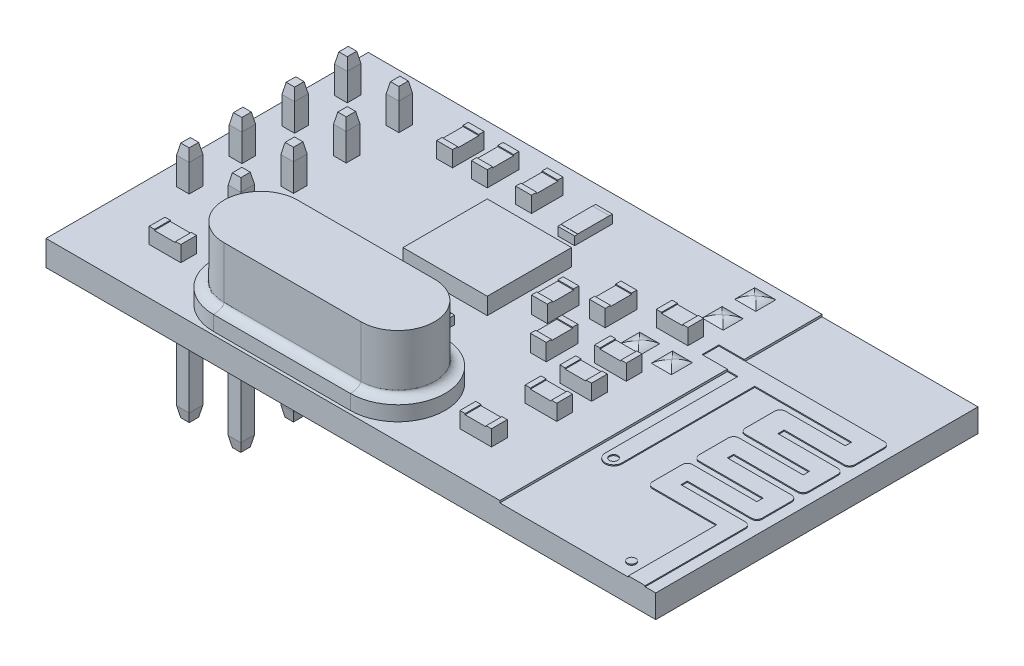
from build123d import *
from OCP.BRepFilletAPI import BRepFilletAPI_MakeChamfer

# Parameters (mm, degrees)
ESBO_O1_W                      = 28.95
ESBO_O1_H                      = 15.3
RESSALTO_EXTRUS_O1_DEPTH       = 1.2
CORTE_EXTRUS_O1_DEPTH          = 0.1
RESSALTO_EXTRUS_O2_DEPTH       = 0.05
ESBO_O4_R                      = 0.2
RESSALTO_EXTRUS_O3_DEPTH       = 0.05
RESSALTO_EXTRUS_O4_DEPTH       = 0.7
RESSALTO_EXTRUS_O5_DEPTH       = 2.7
CORTE_EXTRUS_O2_DEPTH          = 0.05
ESBO_O8_R                      = 0.2
CORTE_EXTRUS_O3_DEPTH          = 0.05
ESBO_O9_W                      = 1.5
ESBO_O9_H                      = 0.75
ESBO_O9_W_2                    = 0.75
ESBO_O9_H_2                    = 1.5
RESSALTO_EXTRUS_O6_DEPTH       = 0.75
FILETE1_SIZE                   = 0.5
FILETE1_SIZE_2                 = 0.25
ESBO_O10_W                     = 5
ESBO_O10_H                     = 2.5
RESSALTO_EXTRUS_O7_DEPTH       = 2.6
CHANFRO2_SIZE                  = 0.709219858
ESBO_O11_W                     = 5
ESBO_O11_H                     = 2.5
RESSALTO_EXTRUS_O8_DEPTH       = 2.6
CHANFRO3_SIZE                  = 0.709219858
ESBO_O12_W                     = 5
ESBO_O12_H                     = 2.5
RESSALTO_EXTRUS_O9_DEPTH       = 2.6
CHANFRO4_SIZE                  = 0.709219858
ESBO_O13_W                     = 5
ESBO_O13_H                     = 2.5
RESSALTO_EXTRUS_O10_DEPTH      = 2.6
CHANFRO5_SIZE                  = 0.709219858
ESBO_O15_W                     = 4
ESBO_O15_H                     = 4
RESSALTO_EXTRUS_O12_DEPTH      = 0.8
ESBO_O16_W                     = 1.8
ESBO_O16_H                     = 0.8
ESBO_O16_W_2                   = 0.8
ESBO_O16_H_2                   = 1.8
RESSALTO_EXTRUS_O13_DEPTH      = 0.4
ESBO_O17_W                     = 0.75
ESBO_O17_H                     = 1.5
RESSALTO_EXTRUS_O14_DEPTH      = 0.8
ESBO_O18_W                     = 0.75
ESBO_O18_H                     = 1
CORTE_EXTRUS_O4_DEPTH          = 0.05
ESBO_O19_W                     = 0.75
ESBO_O19_H                     = 1
ESBO_O19_W_2                   = 1
ESBO_O19_H_2                   = 0.75
CORTE_EXTRUS_O5_DEPTH          = 0.05
ESBO_O20_W                     = 1.5
ESBO_O20_H                     = 0.8
ESBO_O20_W_2                   = 0.8
ESBO_O20_H_2                   = 1.5
RESSALTO_EXTRUS_O15_DEPTH      = 0.01
ESBO_O21_W                     = 1.081560284
ESBO_O21_H                     = 2.6
CORTE_EXTRUS_O6_DEPTH          = 0.001
ESBO_O22_W                     = 3
ESBO_O22_H                     = 1
CORTE_EXTRUS_O7_DEPTH          = 21.860863477
RESSALTO_EXTRUS_O16_DEPTH      = 5.7
RESSALTO_EXTRUS_O16_DEPTH_BACK = 5.6
ESBO_O14_W                     = 0.6
ESBO_O14_H                     = 0.65
CHANFRO8_SIZE                  = 0.5
CHANFRO8_SIZE2                 = 0.1
CHANFRO9_SIZE                  = 0.1
CHANFRO9_SIZE2                 = 0.5
ESBO_O23_W                     = 1
ESBO_O23_H                     = 0.95
ESBO_O23_W_2                   = 0.95
ESBO_O23_H_2                   = 1
RESSALTO_EXTRUS_O17_DEPTH      = 0.15
FILETE2_R                      = 0.75
FILETE3_R                      = 0.25


# Some blends are built 0.0001 mm under size
with BuildPart() as part:
    # Esboço1 → Ressalto-extrusão1 (new body)
    with BuildSketch(Plane(origin=(0, 0, 0), x_dir=(1, 0, 0), z_dir=(0, 1, 0))):
        Rectangle(ESBO_O1_W, ESBO_O1_H)
    extrude(amount=RESSALTO_EXTRUS_O1_DEPTH)

    # Esboço2 → Corte-extrusão1 (cut)
    with BuildSketch(Plane(origin=(0, 1.2, 0), x_dir=(1, 0, 0), z_dir=(0, 1, 0))):
        Polygon((14.475, 7.65), (7.075, 7.65), (7.075, 3.95), (5.875, 3.95), (5.875, 3.15), (7.075, 3.15), (7.075, -7.65), (14.475, -7.65), align=None)
    extrude(amount=-CORTE_EXTRUS_O1_DEPTH, mode=Mode.SUBTRACT)

    # Esboço3 → Ressalto-extrusão2 (add)
    with BuildSketch(Plane(origin=(0, 1.1, 0), x_dir=(1, 0, 0), z_dir=(0, 1, 0))):
        Polygon((7.075, 3.95), (13.975, 3.95), (13.975, 2.05), (10.875, 2.05), (10.875, 1.75), (13.975, 1.75), (13.975, -0.15), (10.675, -0.15), (10.675, -0.45), (13.975, -0.45), (13.975, -2.35), (10.675, -2.35), (10.675, -2.65), (13.975, -2.65), (13.975, -7.65), (13.175, -7.65), (13.175, -3.45), (9.875, -3.45), (9.875, -1.55), (13.175, -1.55), (13.175, -1.25), (9.875, -1.25), (9.875, 0.65), (13.175, 0.65), (13.175, 0.95), (9.875, 0.95), (9.875, 2.85), (12.975, 2.85), (12.975, 3.15), (8.375, 3.15), (8.375, -3.55), (7.575, -3.55), (7.575, 3.15), (7.075, 3.15), (5.875, 3.15), (5.875, 3.95), align=None)
    extrude(amount=RESSALTO_EXTRUS_O2_DEPTH)

    # Esboço4 → Ressalto-extrusão3 (add)
    with BuildSketch(Plane(origin=(0, 1.1, 0), x_dir=(1, 0, 0), z_dir=(0, 1, 0))):
        with Locations(Location((12.625, -6.95, 0), (0, 0, 90))):
            Circle(ESBO_O4_R)
    extrude(amount=RESSALTO_EXTRUS_O3_DEPTH)

    # Esboço5 → Ressalto-extrusão4 (add)
    with BuildSketch(Plane(origin=(0, 1.2, 0), x_dir=(1, 0, 0), z_dir=(0, 1, 0))):
        with BuildLine():
            Line((-6.675, -3), (-0.175, -3))
            ThreePointArc((-0.175, -3), (2.075, -5.25), (-0.175, -7.5))
            Line((-0.175, -7.5), (-6.675, -7.5))
            ThreePointArc((-6.675, -7.5), (-8.925, -5.25), (-6.675, -3))
        make_face()
    extrude(amount=RESSALTO_EXTRUS_O4_DEPTH)

    # Esboço6 → Ressalto-extrusão5 (add)
    with BuildSketch(Plane(origin=(0, 1.9, 0), x_dir=(1, 0, 0), z_dir=(0, 1, 0))):
        with BuildLine():
            Line((-6.675, -3.5), (-0.175, -3.5))
            ThreePointArc((-0.175, -3.5), (1.575, -5.25), (-0.175, -7))
            Line((-0.175, -7), (-6.675, -7))
            ThreePointArc((-6.675, -7), (-8.425, -5.25), (-6.675, -3.5))
        make_face()
    extrude(amount=RESSALTO_EXTRUS_O5_DEPTH)

    # Esboço7 → Corte-extrusão2 (cut)
    with BuildSketch(Plane(origin=(0, 1.15, 0), x_dir=(1, 0, 0), z_dir=(0, 1, 0))):
        with BuildLine():
            ThreePointArc((8.375, -3.15), (8.257842712, -3.432842712), (7.975, -3.55))
            Line((7.975, -3.55), (8.375, -3.55))
            Line((8.375, -3.55), (8.375, -3.15))
        make_face()
        with BuildLine():
            ThreePointArc((7.975, -3.55), (7.692157288, -3.432842712), (7.575, -3.15))
            Line((7.575, -3.15), (7.575, -3.55))
            Line((7.575, -3.55), (7.975, -3.55))
        make_face()
    extrude(amount=-CORTE_EXTRUS_O2_DEPTH, mode=Mode.SUBTRACT)

    # Esboço8 → Corte-extrusão3 (cut)
    with BuildSketch(Plane(origin=(0, 1.15, 0), x_dir=(1, 0, 0), z_dir=(0, 1, 0))):
        with Locations(Location((7.975, -3.15, 0), (0, 0, 270))):
            Circle(ESBO_O8_R)
    extrude(amount=-CORTE_EXTRUS_O3_DEPTH, mode=Mode.SUBTRACT)

    # Esboço9 → Ressalto-extrusão6 (add)
    with BuildSketch(Plane(origin=(0, 1.2, 0), x_dir=(1, 0, 0), z_dir=(0, 1, 0))):
        with Locations((-11.025, -5.075)):
            Rectangle(ESBO_O9_W, ESBO_O9_H)
        with Locations((3.925, -5.275)):
            Rectangle(ESBO_O9_W, ESBO_O9_H)
        with Locations((4.425, -2.675)):
            Rectangle(ESBO_O9_W, ESBO_O9_H)
        with Locations((4.425, -1.025)):
            Rectangle(ESBO_O9_W, ESBO_O9_H)
        with Locations((4.425, 0.625)):
            Rectangle(ESBO_O9_W, ESBO_O9_H)
        with Locations((4.425, 3.55)):
            Rectangle(ESBO_O9_W, ESBO_O9_H)
        with Locations((-8.1, 5.65)):
            Rectangle(ESBO_O9_W_2, ESBO_O9_H_2)
        with Locations((-6.45, 5.65)):
            Rectangle(ESBO_O9_W_2, ESBO_O9_H_2)
        with Locations((-4.35, 5.65)):
            Rectangle(ESBO_O9_W_2, ESBO_O9_H_2)
    extrude(amount=RESSALTO_EXTRUS_O6_DEPTH)

    # Filete1
    # a fillet whose section is not a circle: 0.5, 0.25 mm, written as the material it adds along each edge
    with BuildSketch(Plane(origin=(-6.675, 1.9, 5.25), x_dir=(0, 0, 1), z_dir=(1, 0, 0))) as filete1_piece_1:
        with BuildLine():
            Bezier((1.75 + FILETE1_SIZE, 0), (1.75, 0), (1.75, -FILETE1_SIZE_2), weights=[1, 0.707106781, 1])
            Line((1.75, -FILETE1_SIZE_2), (1.75, 0))
            Line((1.75, 0), (1.75 + FILETE1_SIZE, 0))
        make_face()
    revolve(axis=Axis((-6.675, 1.9, 5.25), (0, -1, 0)), revolution_arc=180)
    with BuildSketch(Plane(origin=(-0.175, 1.9, 7), x_dir=(0, 0, 1), z_dir=(-1, 0, 0)), Plane(origin=(-6.675, 1.9, 3.5), x_dir=(0, 0, -1), z_dir=(1, 0, 0))) as filete1_piece_2:
        with BuildLine():
            Bezier((FILETE1_SIZE, 0), (0, 0), (0, FILETE1_SIZE_2), weights=[1, 0.707106781, 1])
            Line((0, FILETE1_SIZE_2), (0, 0))
            Line((0, 0), (FILETE1_SIZE, 0))
        make_face()
    extrude(amount=6.5)
    with BuildSketch(Plane(origin=(-0.175, 1.9, 5.25), x_dir=(0, 0, -1), z_dir=(-1, 0, 0))) as filete1_piece_3:
        with BuildLine():
            Bezier((1.75 + FILETE1_SIZE, 0), (1.75, 0), (1.75, -FILETE1_SIZE_2), weights=[1, 0.707106781, 1])
            Line((1.75, -FILETE1_SIZE_2), (1.75, 0))
            Line((1.75, 0), (1.75 + FILETE1_SIZE, 0))
        make_face()
    revolve(axis=Axis((-0.175, 1.9, 5.25), (0, -1, 0)), revolution_arc=180)

    # Esboço10 → Ressalto-extrusão7 (add)
    with BuildSketch(Plane.XZ):
        with Locations((-11.975, -5.4)):
            Rectangle(ESBO_O10_W, ESBO_O10_H)
    extrude(amount=RESSALTO_EXTRUS_O7_DEPTH)

    # Chanfro2
    chanfro2_edges = [part.edges().sort_by_distance(p)[0] for p in [
        (-14.475, -1.3, -4.15),
        (-9.475, -1.3, -4.15),
    ]]
    chamfer(chanfro2_edges, length=CHANFRO2_SIZE)

    # Esboço11 → Ressalto-extrusão8 (add)
    with BuildSketch(Plane.XZ):
        with Locations((-11.975, -2.9)):
            Rectangle(ESBO_O11_W, ESBO_O11_H)
    extrude(amount=RESSALTO_EXTRUS_O8_DEPTH)

    # Chanfro3
    chanfro3_edges = [part.edges().sort_by_distance(p)[0] for p in [
        (-14.475, -1.3, -1.65),
        (-9.475, -1.3, -1.65),
    ]]
    chamfer(chanfro3_edges, length=CHANFRO3_SIZE)

    # Esboço12 → Ressalto-extrusão9 (add)
    with BuildSketch(Plane.XZ):
        with Locations((-11.975, -0.4)):
            Rectangle(ESBO_O12_W, ESBO_O12_H)
    extrude(amount=RESSALTO_EXTRUS_O9_DEPTH)

    # Chanfro4
    chanfro4_edges = [part.edges().sort_by_distance(p)[0] for p in [
        (-14.475, -1.3, 0.85),
        (-9.475, -1.3, 0.85),
    ]]
    chamfer(chanfro4_edges, length=CHANFRO4_SIZE)

    # Esboço13 → Ressalto-extrusão10 (add)
    with BuildSketch(Plane.XZ):
        with Locations((-11.975, 2.1)):
            Rectangle(ESBO_O13_W, ESBO_O13_H)
    extrude(amount=RESSALTO_EXTRUS_O10_DEPTH)

    # Chanfro5
    chanfro5_edges = [part.edges().sort_by_distance(p)[0] for p in [
        (-9.475, -1.3, -6.65),
        (-14.475, -1.3, -6.65),
        (-9.475, -1.3, -4.15),
        (-14.475, -1.3, -4.15),
        (-9.475, -1.3, -1.65),
        (-14.475, -1.3, -1.65),
        (-14.475, -1.3, 0.85),
        (-9.475, -1.3, 0.85),
        (-9.475, -1.3, 3.35),
        (-14.475, -1.3, 3.35),
    ]]
    chamfer(chanfro5_edges, length=CHANFRO5_SIZE - 0.0001)  # a hair under: the kernel refuses the full size

    # Esboço15 → Ressalto-extrusão12 (add)
    with BuildSketch(Plane(origin=(0, 1.2, 0), x_dir=(1, 0, 0), z_dir=(0, 1, 0))):
        with Locations((-2.825, 1.65)):
            Rectangle(ESBO_O15_W, ESBO_O15_H)
    extrude(amount=RESSALTO_EXTRUS_O12_DEPTH)

    # Esboço16 → Ressalto-extrusão13 (add)
    with BuildSketch(Plane(origin=(0, 1.2, 0), x_dir=(1, 0, 0), z_dir=(0, 1, 0))):
        with Locations((-2.125, -1.9)):
            Rectangle(ESBO_O16_W, ESBO_O16_H)
        with Locations((-2.025, 5.5)):
            Rectangle(ESBO_O16_W_2, ESBO_O16_H_2)
    extrude(amount=RESSALTO_EXTRUS_O13_DEPTH)

    # Esboço17 → Ressalto-extrusão14 (add)
    with BuildSketch(Plane(origin=(0, 1.2, 0), x_dir=(1, 0, 0), z_dir=(0, 1, 0))):
        with Locations((0.55, 1.5)):
            Rectangle(ESBO_O17_W, ESBO_O17_H)
        with Locations((2.1, -0.1)):
            Rectangle(ESBO_O17_W, ESBO_O17_H)
        with Locations((2.1, 2.7)):
            Rectangle(ESBO_O17_W, ESBO_O17_H)
    extrude(amount=RESSALTO_EXTRUS_O14_DEPTH)

    # Esboço18 → Corte-extrusão4 (cut)
    with BuildSketch(Plane(origin=(0, 2, 0), x_dir=(1, 0, 0), z_dir=(0, 1, 0))):
        with Locations((2.1, -0.1)):
            Rectangle(ESBO_O18_W, ESBO_O18_H)
        with Locations((0.55, 1.5)):
            Rectangle(ESBO_O18_W, ESBO_O18_H)
        with Locations((2.1, 2.7)):
            Rectangle(ESBO_O18_W, ESBO_O18_H)
    extrude(amount=-CORTE_EXTRUS_O4_DEPTH, mode=Mode.SUBTRACT)

    # Esboço19 → Corte-extrusão5 (cut)
    with BuildSketch(Plane(origin=(0, 1.95, 0), x_dir=(1, 0, 0), z_dir=(0, 1, 0))):
        with Locations((-4.35, 5.65)):
            Rectangle(ESBO_O19_W, ESBO_O19_H)
        with Locations((-6.45, 5.65)):
            Rectangle(ESBO_O19_W, ESBO_O19_H)
        with Locations((-8.1, 5.65)):
            Rectangle(ESBO_O19_W, ESBO_O19_H)
        with Locations((4.425, 3.55)):
            Rectangle(ESBO_O19_W_2, ESBO_O19_H_2)
        with Locations((4.425, 0.625)):
            Rectangle(ESBO_O19_W_2, ESBO_O19_H_2)
        with Locations((4.425, -1.025)):
            Rectangle(ESBO_O19_W_2, ESBO_O19_H_2)
        with Locations((4.425, -2.675)):
            Rectangle(ESBO_O19_W_2, ESBO_O19_H_2)
        with Locations((3.925, -5.275)):
            Rectangle(ESBO_O19_W_2, ESBO_O19_H_2)
        with Locations((-11.025, -5.075)):
            Rectangle(ESBO_O19_W_2, ESBO_O19_H_2)
    extrude(amount=-CORTE_EXTRUS_O5_DEPTH, mode=Mode.SUBTRACT)

    # Esboço20 → Ressalto-extrusão15 (add)
    with BuildSketch(Plane(origin=(0, 1.6, 0), x_dir=(1, 0, 0), z_dir=(0, 1, 0))):
        with Locations((-2.125, -1.9)):
            Rectangle(ESBO_O20_W, ESBO_O20_H)
        with Locations((-2.025, 5.5)):
            Rectangle(ESBO_O20_W_2, ESBO_O20_H_2)
    extrude(amount=RESSALTO_EXTRUS_O15_DEPTH)

    # Esboço21 → Corte-extrusão6 (cut)
    with BuildSketch(Plane.ZY.offset(14.475)):
        with Locations((2.1, -1.3)):
            Rectangle(ESBO_O21_W, ESBO_O21_H)
        with Locations((-0.4, -1.3)):
            Rectangle(ESBO_O21_W, ESBO_O21_H)
        with Locations((-2.9, -1.3)):
            Rectangle(ESBO_O21_W, ESBO_O21_H)
        with Locations((-5.4, -1.3)):
            Rectangle(ESBO_O21_W, ESBO_O21_H)
    extrude(amount=-CORTE_EXTRUS_O6_DEPTH, mode=Mode.SUBTRACT)

    # Esboço22 → Corte-extrusão7 (cut, through all)
    with BuildSketch(Plane(origin=(0, 0, -6.65), x_dir=(-1, 0, 0), z_dir=(0, 0, -1))):
        with Locations((11.974219858, -0.5)):
            Rectangle(ESBO_O22_W, ESBO_O22_H)
    extrude(amount=-CORTE_EXTRUS_O7_DEPTH, mode=Mode.SUBTRACT)

    # Esboço14 → Ressalto-extrusão16 (add, two sides: drawn at the far end of the back side and taken through both)
    with BuildSketch(Plane.XZ.offset(2.6).offset(-RESSALTO_EXTRUS_O16_DEPTH_BACK)):
        with Locations((-13.2, 2.1)):
            Rectangle(ESBO_O14_W, ESBO_O14_H)
        with Locations((-10.75, 2.1)):
            Rectangle(ESBO_O14_W, ESBO_O14_H)
        with Locations((-13.2, -0.4)):
            Rectangle(ESBO_O14_W, ESBO_O14_H)
        with Locations((-10.75, -0.4)):
            Rectangle(ESBO_O14_W, ESBO_O14_H)
        with Locations((-13.196951429, -2.9)):
            Rectangle(ESBO_O14_W, ESBO_O14_H)
        with Locations((-10.746951429, -2.9)):
            Rectangle(ESBO_O14_W, ESBO_O14_H)
        with Locations((-13.196951429, -5.4)):
            Rectangle(ESBO_O14_W, ESBO_O14_H)
        with Locations((-10.746951429, -5.4)):
            Rectangle(ESBO_O14_W, ESBO_O14_H)
    extrude(amount=RESSALTO_EXTRUS_O16_DEPTH + RESSALTO_EXTRUS_O16_DEPTH_BACK)

    # Chanfro8: one chamfer whose edges measure the first distance from different faces: ONE call of the kernel's chamfer builder (chamfer() names one face for all edges)
    chanfro8_edges_1 = [part.edges().sort_by_distance(p)[0] for p in [
        (-11.05, -8.3, -0.4),
    ]]
    chanfro8_side_1 = [part.faces().sort_by_distance(p)[0] for p in [
        (-11.05, -5.45, -0.4),
    ]]
    chanfro8_edges_2 = [part.edges().sort_by_distance(p)[0] for p in [
        (-10.75, -8.3, -0.725),
    ]]
    chanfro8_side_2 = [part.faces().sort_by_distance(p)[0] for p in [
        (-10.75, -5.45, -0.725),
    ]]
    chanfro8_edges_3 = [part.edges().sort_by_distance(p)[0] for p in [
        (-10.45, -8.3, -0.4),
    ]]
    chanfro8_side_3 = [part.faces().sort_by_distance(p)[0] for p in [
        (-10.45, -5.45, -0.4),
    ]]
    chanfro8_edges_4 = [part.edges().sort_by_distance(p)[0] for p in [
        (-10.75, -8.3, -0.075),
    ]]
    chanfro8_side_4 = [part.faces().sort_by_distance(p)[0] for p in [
        (-10.75, -5.45, -0.075),
    ]]
    chanfro8_edges_5 = [part.edges().sort_by_distance(p)[0] for p in [
        (-13.496951429, -8.3, -2.9),
    ]]
    chanfro8_side_5 = [part.faces().sort_by_distance(p)[0] for p in [
        (-13.496951429, -5.45, -2.9),
    ]]
    chanfro8_edges_6 = [part.edges().sort_by_distance(p)[0] for p in [
        (-13.196951429, -8.3, -3.225),
    ]]
    chanfro8_side_6 = [part.faces().sort_by_distance(p)[0] for p in [
        (-13.196951429, -5.45, -3.225),
    ]]
    chanfro8_edges_7 = [part.edges().sort_by_distance(p)[0] for p in [
        (-12.896951429, -8.3, -2.9),
    ]]
    chanfro8_side_7 = [part.faces().sort_by_distance(p)[0] for p in [
        (-12.896951429, -5.45, -2.9),
    ]]
    chanfro8_edges_8 = [part.edges().sort_by_distance(p)[0] for p in [
        (-13.196951429, -8.3, -2.575),
    ]]
    chanfro8_side_8 = [part.faces().sort_by_distance(p)[0] for p in [
        (-13.196951429, -5.45, -2.575),
    ]]
    chanfro8_edges_9 = [part.edges().sort_by_distance(p)[0] for p in [
        (-11.046951429, -8.3, -2.9),
    ]]
    chanfro8_side_9 = [part.faces().sort_by_distance(p)[0] for p in [
        (-11.046951429, -5.45, -2.9),
    ]]
    chanfro8_edges_10 = [part.edges().sort_by_distance(p)[0] for p in [
        (-10.746951429, -8.3, -3.225),
    ]]
    chanfro8_side_10 = [part.faces().sort_by_distance(p)[0] for p in [
        (-10.746951429, -5.45, -3.225),
    ]]
    chanfro8_edges_11 = [part.edges().sort_by_distance(p)[0] for p in [
        (-10.446951429, -8.3, -2.9),
    ]]
    chanfro8_side_11 = [part.faces().sort_by_distance(p)[0] for p in [
        (-10.446951429, -5.45, -2.9),
    ]]
    chanfro8_edges_12 = [part.edges().sort_by_distance(p)[0] for p in [
        (-10.746951429, -8.3, -2.575),
    ]]
    chanfro8_side_12 = [part.faces().sort_by_distance(p)[0] for p in [
        (-10.746951429, -5.45, -2.575),
    ]]
    chanfro8_edges_13 = [part.edges().sort_by_distance(p)[0] for p in [
        (-13.496951429, -8.3, -5.4),
    ]]
    chanfro8_side_13 = [part.faces().sort_by_distance(p)[0] for p in [
        (-13.496951429, -5.45, -5.4),
    ]]
    chanfro8_edges_14 = [part.edges().sort_by_distance(p)[0] for p in [
        (-13.196951429, -8.3, -5.725),
    ]]
    chanfro8_side_14 = [part.faces().sort_by_distance(p)[0] for p in [
        (-13.196951429, -5.45, -5.725),
    ]]
    chanfro8_edges_15 = [part.edges().sort_by_distance(p)[0] for p in [
        (-12.896951429, -8.3, -5.4),
    ]]
    chanfro8_side_15 = [part.faces().sort_by_distance(p)[0] for p in [
        (-12.896951429, -5.45, -5.4),
    ]]
    chanfro8_edges_16 = [part.edges().sort_by_distance(p)[0] for p in [
        (-13.196951429, -8.3, -5.075),
    ]]
    chanfro8_side_16 = [part.faces().sort_by_distance(p)[0] for p in [
        (-13.196951429, -5.45, -5.075),
    ]]
    chanfro8_edges_17 = [part.edges().sort_by_distance(p)[0] for p in [
        (-11.046951429, -8.3, -5.4),
    ]]
    chanfro8_side_17 = [part.faces().sort_by_distance(p)[0] for p in [
        (-11.046951429, -5.45, -5.4),
    ]]
    chanfro8_edges_18 = [part.edges().sort_by_distance(p)[0] for p in [
        (-10.746951429, -8.3, -5.725),
    ]]
    chanfro8_side_18 = [part.faces().sort_by_distance(p)[0] for p in [
        (-10.746951429, -5.45, -5.725),
    ]]
    chanfro8_edges_19 = [part.edges().sort_by_distance(p)[0] for p in [
        (-10.446951429, -8.3, -5.4),
    ]]
    chanfro8_side_19 = [part.faces().sort_by_distance(p)[0] for p in [
        (-10.446951429, -5.45, -5.4),
    ]]
    chanfro8_edges_20 = [part.edges().sort_by_distance(p)[0] for p in [
        (-10.746951429, -8.3, -5.075),
    ]]
    chanfro8_side_20 = [part.faces().sort_by_distance(p)[0] for p in [
        (-10.746951429, -5.45, -5.075),
    ]]
    chanfro8_edges_21 = [part.edges().sort_by_distance(p)[0] for p in [
        (-13.5, -8.3, 2.1),
    ]]
    chanfro8_side_21 = [part.faces().sort_by_distance(p)[0] for p in [
        (-13.5, -5.45, 2.1),
    ]]
    chanfro8_edges_22 = [part.edges().sort_by_distance(p)[0] for p in [
        (-13.2, -8.3, 1.775),
    ]]
    chanfro8_side_22 = [part.faces().sort_by_distance(p)[0] for p in [
        (-13.2, -5.45, 1.775),
    ]]
    chanfro8_edges_23 = [part.edges().sort_by_distance(p)[0] for p in [
        (-12.9, -8.3, 2.1),
    ]]
    chanfro8_side_23 = [part.faces().sort_by_distance(p)[0] for p in [
        (-12.9, -5.45, 2.1),
    ]]
    chanfro8_edges_24 = [part.edges().sort_by_distance(p)[0] for p in [
        (-13.2, -8.3, 2.425),
    ]]
    chanfro8_side_24 = [part.faces().sort_by_distance(p)[0] for p in [
        (-13.2, -5.45, 2.425),
    ]]
    chanfro8_edges_25 = [part.edges().sort_by_distance(p)[0] for p in [
        (-11.05, -8.3, 2.1),
    ]]
    chanfro8_side_25 = [part.faces().sort_by_distance(p)[0] for p in [
        (-11.05, -5.45, 2.1),
    ]]
    chanfro8_edges_26 = [part.edges().sort_by_distance(p)[0] for p in [
        (-10.75, -8.3, 1.775),
    ]]
    chanfro8_side_26 = [part.faces().sort_by_distance(p)[0] for p in [
        (-10.75, -5.45, 1.775),
    ]]
    chanfro8_edges_27 = [part.edges().sort_by_distance(p)[0] for p in [
        (-10.45, -8.3, 2.1),
    ]]
    chanfro8_side_27 = [part.faces().sort_by_distance(p)[0] for p in [
        (-10.45, -5.45, 2.1),
    ]]
    chanfro8_edges_28 = [part.edges().sort_by_distance(p)[0] for p in [
        (-10.75, -8.3, 2.425),
    ]]
    chanfro8_side_28 = [part.faces().sort_by_distance(p)[0] for p in [
        (-10.75, -5.45, 2.425),
    ]]
    chanfro8_edges_29 = [part.edges().sort_by_distance(p)[0] for p in [
        (-13.5, -8.3, -0.4),
    ]]
    chanfro8_side_29 = [part.faces().sort_by_distance(p)[0] for p in [
        (-13.5, -5.45, -0.4),
    ]]
    chanfro8_edges_30 = [part.edges().sort_by_distance(p)[0] for p in [
        (-13.2, -8.3, -0.725),
    ]]
    chanfro8_side_30 = [part.faces().sort_by_distance(p)[0] for p in [
        (-13.2, -5.45, -0.725),
    ]]
    chanfro8_edges_31 = [part.edges().sort_by_distance(p)[0] for p in [
        (-12.9, -8.3, -0.4),
    ]]
    chanfro8_side_31 = [part.faces().sort_by_distance(p)[0] for p in [
        (-12.9, -5.45, -0.4),
    ]]
    chanfro8_edges_32 = [part.edges().sort_by_distance(p)[0] for p in [
        (-13.2, -8.3, -0.075),
    ]]
    chanfro8_side_32 = [part.faces().sort_by_distance(p)[0] for p in [
        (-13.2, -5.45, -0.075),
    ]]
    chanfro8 = BRepFilletAPI_MakeChamfer(part.part.solid().wrapped)
    for e in chanfro8_edges_1:
        chanfro8.Add(CHANFRO8_SIZE, CHANFRO8_SIZE2, e.wrapped, chanfro8_side_1[0].wrapped)  # the first distance lies on this face
    for e in chanfro8_edges_2:
        chanfro8.Add(CHANFRO8_SIZE, CHANFRO8_SIZE2, e.wrapped, chanfro8_side_2[0].wrapped)  # the first distance lies on this face
    for e in chanfro8_edges_3:
        chanfro8.Add(CHANFRO8_SIZE, CHANFRO8_SIZE2, e.wrapped, chanfro8_side_3[0].wrapped)  # the first distance lies on this face
    for e in chanfro8_edges_4:
        chanfro8.Add(CHANFRO8_SIZE, CHANFRO8_SIZE2, e.wrapped, chanfro8_side_4[0].wrapped)  # the first distance lies on this face
    for e in chanfro8_edges_5:
        chanfro8.Add(CHANFRO8_SIZE, CHANFRO8_SIZE2, e.wrapped, chanfro8_side_5[0].wrapped)  # the first distance lies on this face
    for e in chanfro8_edges_6:
        chanfro8.Add(CHANFRO8_SIZE, CHANFRO8_SIZE2, e.wrapped, chanfro8_side_6[0].wrapped)  # the first distance lies on this face
    for e in chanfro8_edges_7:
        chanfro8.Add(CHANFRO8_SIZE, CHANFRO8_SIZE2, e.wrapped, chanfro8_side_7[0].wrapped)  # the first distance lies on this face
    for e in chanfro8_edges_8:
        chanfro8.Add(CHANFRO8_SIZE, CHANFRO8_SIZE2, e.wrapped, chanfro8_side_8[0].wrapped)  # the first distance lies on this face
    for e in chanfro8_edges_9:
        chanfro8.Add(CHANFRO8_SIZE, CHANFRO8_SIZE2, e.wrapped, chanfro8_side_9[0].wrapped)  # the first distance lies on this face
    for e in chanfro8_edges_10:
        chanfro8.Add(CHANFRO8_SIZE, CHANFRO8_SIZE2, e.wrapped, chanfro8_side_10[0].wrapped)  # the first distance lies on this face
    for e in chanfro8_edges_11:
        chanfro8.Add(CHANFRO8_SIZE, CHANFRO8_SIZE2, e.wrapped, chanfro8_side_11[0].wrapped)  # the first distance lies on this face
    for e in chanfro8_edges_12:
        chanfro8.Add(CHANFRO8_SIZE, CHANFRO8_SIZE2, e.wrapped, chanfro8_side_12[0].wrapped)  # the first distance lies on this face
    for e in chanfro8_edges_13:
        chanfro8.Add(CHANFRO8_SIZE, CHANFRO8_SIZE2, e.wrapped, chanfro8_side_13[0].wrapped)  # the first distance lies on this face
    for e in chanfro8_edges_14:
        chanfro8.Add(CHANFRO8_SIZE, CHANFRO8_SIZE2, e.wrapped, chanfro8_side_14[0].wrapped)  # the first distance lies on this face
    for e in chanfro8_edges_15:
        chanfro8.Add(CHANFRO8_SIZE, CHANFRO8_SIZE2, e.wrapped, chanfro8_side_15[0].wrapped)  # the first distance lies on this face
    for e in chanfro8_edges_16:
        chanfro8.Add(CHANFRO8_SIZE, CHANFRO8_SIZE2, e.wrapped, chanfro8_side_16[0].wrapped)  # the first distance lies on this face
    for e in chanfro8_edges_17:
        chanfro8.Add(CHANFRO8_SIZE, CHANFRO8_SIZE2, e.wrapped, chanfro8_side_17[0].wrapped)  # the first distance lies on this face
    for e in chanfro8_edges_18:
        chanfro8.Add(CHANFRO8_SIZE, CHANFRO8_SIZE2, e.wrapped, chanfro8_side_18[0].wrapped)  # the first distance lies on this face
    for e in chanfro8_edges_19:
        chanfro8.Add(CHANFRO8_SIZE, CHANFRO8_SIZE2, e.wrapped, chanfro8_side_19[0].wrapped)  # the first distance lies on this face
    for e in chanfro8_edges_20:
        chanfro8.Add(CHANFRO8_SIZE, CHANFRO8_SIZE2, e.wrapped, chanfro8_side_20[0].wrapped)  # the first distance lies on this face
    for e in chanfro8_edges_21:
        chanfro8.Add(CHANFRO8_SIZE, CHANFRO8_SIZE2, e.wrapped, chanfro8_side_21[0].wrapped)  # the first distance lies on this face
    for e in chanfro8_edges_22:
        chanfro8.Add(CHANFRO8_SIZE, CHANFRO8_SIZE2, e.wrapped, chanfro8_side_22[0].wrapped)  # the first distance lies on this face
    for e in chanfro8_edges_23:
        chanfro8.Add(CHANFRO8_SIZE, CHANFRO8_SIZE2, e.wrapped, chanfro8_side_23[0].wrapped)  # the first distance lies on this face
    for e in chanfro8_edges_24:
        chanfro8.Add(CHANFRO8_SIZE, CHANFRO8_SIZE2, e.wrapped, chanfro8_side_24[0].wrapped)  # the first distance lies on this face
    for e in chanfro8_edges_25:
        chanfro8.Add(CHANFRO8_SIZE, CHANFRO8_SIZE2, e.wrapped, chanfro8_side_25[0].wrapped)  # the first distance lies on this face
    for e in chanfro8_edges_26:
        chanfro8.Add(CHANFRO8_SIZE, CHANFRO8_SIZE2, e.wrapped, chanfro8_side_26[0].wrapped)  # the first distance lies on this face
    for e in chanfro8_edges_27:
        chanfro8.Add(CHANFRO8_SIZE, CHANFRO8_SIZE2, e.wrapped, chanfro8_side_27[0].wrapped)  # the first distance lies on this face
    for e in chanfro8_edges_28:
        chanfro8.Add(CHANFRO8_SIZE, CHANFRO8_SIZE2, e.wrapped, chanfro8_side_28[0].wrapped)  # the first distance lies on this face
    for e in chanfro8_edges_29:
        chanfro8.Add(CHANFRO8_SIZE, CHANFRO8_SIZE2, e.wrapped, chanfro8_side_29[0].wrapped)  # the first distance lies on this face
    for e in chanfro8_edges_30:
        chanfro8.Add(CHANFRO8_SIZE, CHANFRO8_SIZE2, e.wrapped, chanfro8_side_30[0].wrapped)  # the first distance lies on this face
    for e in chanfro8_edges_31:
        chanfro8.Add(CHANFRO8_SIZE, CHANFRO8_SIZE2, e.wrapped, chanfro8_side_31[0].wrapped)  # the first distance lies on this face
    for e in chanfro8_edges_32:
        chanfro8.Add(CHANFRO8_SIZE, CHANFRO8_SIZE2, e.wrapped, chanfro8_side_32[0].wrapped)  # the first distance lies on this face
    add(Compound.cast(chanfro8.Shape()), mode=Mode.REPLACE)

    # Chanfro9: one chamfer whose edges measure the first distance from different faces: ONE call of the kernel's chamfer builder (chamfer() names one face for all edges)
    chanfro9_edges_1 = [part.edges().sort_by_distance(p)[0] for p in [
        (-11.05, 3, -0.4),
        (-10.75, 3, -0.075),
        (-10.45, 3, -0.4),
        (-10.75, 3, -0.725),
    ]]
    chanfro9_side_1 = [part.faces().sort_by_distance(p)[0] for p in [
        (-10.75, 3, -0.4),
    ]]
    chanfro9_edges_2 = [part.edges().sort_by_distance(p)[0] for p in [
        (-12.896951429, 3, -2.9),
        (-13.496951429, 3, -2.9),
        (-13.196951429, 3, -2.575),
        (-13.196951429, 3, -3.225),
    ]]
    chanfro9_side_2 = [part.faces().sort_by_distance(p)[0] for p in [
        (-13.196951429, 3, -2.9),
    ]]
    chanfro9_edges_3 = [part.edges().sort_by_distance(p)[0] for p in [
        (-11.046951429, 3, -2.9),
        (-10.746951429, 3, -2.575),
        (-10.446951429, 3, -2.9),
        (-10.746951429, 3, -3.225),
    ]]
    chanfro9_side_3 = [part.faces().sort_by_distance(p)[0] for p in [
        (-10.746951429, 3, -2.9),
    ]]
    chanfro9_edges_4 = [part.edges().sort_by_distance(p)[0] for p in [
        (-12.896951429, 3, -5.4),
        (-13.496951429, 3, -5.4),
        (-13.196951429, 3, -5.075),
        (-13.196951429, 3, -5.725),
    ]]
    chanfro9_side_4 = [part.faces().sort_by_distance(p)[0] for p in [
        (-13.196951429, 3, -5.4),
    ]]
    chanfro9_edges_5 = [part.edges().sort_by_distance(p)[0] for p in [
        (-11.046951429, 3, -5.4),
        (-10.746951429, 3, -5.075),
        (-10.446951429, 3, -5.4),
        (-10.746951429, 3, -5.725),
    ]]
    chanfro9_side_5 = [part.faces().sort_by_distance(p)[0] for p in [
        (-10.746951429, 3, -5.4),
    ]]
    chanfro9_edges_6 = [part.edges().sort_by_distance(p)[0] for p in [
        (-12.9, 3, 2.1),
        (-13.5, 3, 2.1),
        (-13.2, 3, 2.425),
        (-13.2, 3, 1.775),
    ]]
    chanfro9_side_6 = [part.faces().sort_by_distance(p)[0] for p in [
        (-13.2, 3, 2.1),
    ]]
    chanfro9_edges_7 = [part.edges().sort_by_distance(p)[0] for p in [
        (-11.05, 3, 2.1),
        (-10.75, 3, 2.425),
        (-10.45, 3, 2.1),
        (-10.75, 3, 1.775),
    ]]
    chanfro9_side_7 = [part.faces().sort_by_distance(p)[0] for p in [
        (-10.75, 3, 2.1),
    ]]
    chanfro9_edges_8 = [part.edges().sort_by_distance(p)[0] for p in [
        (-12.9, 3, -0.4),
        (-13.5, 3, -0.4),
        (-13.2, 3, -0.075),
        (-13.2, 3, -0.725),
    ]]
    chanfro9_side_8 = [part.faces().sort_by_distance(p)[0] for p in [
        (-13.2, 3, -0.4),
    ]]
    chanfro9 = BRepFilletAPI_MakeChamfer(part.part.solid().wrapped)
    for e in chanfro9_edges_1:
        chanfro9.Add(CHANFRO9_SIZE, CHANFRO9_SIZE2, e.wrapped, chanfro9_side_1[0].wrapped)  # the first distance lies on this face
    for e in chanfro9_edges_2:
        chanfro9.Add(CHANFRO9_SIZE, CHANFRO9_SIZE2, e.wrapped, chanfro9_side_2[0].wrapped)  # the first distance lies on this face
    for e in chanfro9_edges_3:
        chanfro9.Add(CHANFRO9_SIZE, CHANFRO9_SIZE2, e.wrapped, chanfro9_side_3[0].wrapped)  # the first distance lies on this face
    for e in chanfro9_edges_4:
        chanfro9.Add(CHANFRO9_SIZE, CHANFRO9_SIZE2, e.wrapped, chanfro9_side_4[0].wrapped)  # the first distance lies on this face
    for e in chanfro9_edges_5:
        chanfro9.Add(CHANFRO9_SIZE, CHANFRO9_SIZE2, e.wrapped, chanfro9_side_5[0].wrapped)  # the first distance lies on this face
    for e in chanfro9_edges_6:
        chanfro9.Add(CHANFRO9_SIZE, CHANFRO9_SIZE2, e.wrapped, chanfro9_side_6[0].wrapped)  # the first distance lies on this face
    for e in chanfro9_edges_7:
        chanfro9.Add(CHANFRO9_SIZE, CHANFRO9_SIZE2, e.wrapped, chanfro9_side_7[0].wrapped)  # the first distance lies on this face
    for e in chanfro9_edges_8:
        chanfro9.Add(CHANFRO9_SIZE, CHANFRO9_SIZE2, e.wrapped, chanfro9_side_8[0].wrapped)  # the first distance lies on this face
    add(Compound.cast(chanfro9.Shape()), mode=Mode.REPLACE)

    # Esboço23 → Ressalto-extrusão17 (add)
    with BuildSketch(Plane(origin=(0, 1.2, 0), x_dir=(1, 0, 0), z_dir=(0, 1, 0))):
        with Locations((4.875, 6.675)):
            Rectangle(ESBO_O23_W, ESBO_O23_H)
        with Locations((4.875, 5.125)):
            Rectangle(ESBO_O23_W, ESBO_O23_H)
        with Locations((3.95, 2.09)):
            Rectangle(ESBO_O23_W_2, ESBO_O23_H_2)
        with Locations((5.5, 2.09)):
            Rectangle(ESBO_O23_W_2, ESBO_O23_H_2)
    extrude(amount=RESSALTO_EXTRUS_O17_DEPTH)

    # Filete2
    # the kernel refuses this fillet: 0.75 mm, written as the material it takes off along each edge
    with BuildSketch(Plane(origin=(3.25, 1.35, -5.6), x_dir=(0, -1, 0), z_dir=(1, 0, 0)), Plane(origin=(6.5, 1.35, -4.65), x_dir=(0, -1, 0), z_dir=(-1, 0, 0)), Plane(origin=(3.25, 1.35, -7.15), x_dir=(0, -1, 0), z_dir=(1, 0, 0)), Plane(origin=(6.5, 1.35, -6.2), x_dir=(0, -1, 0), z_dir=(-1, 0, 0)), Plane(origin=(5.975, 1.35, -3.715), x_dir=(0, -1, 0), z_dir=(0, 0, 1))) as filete2_piece_1:
        with BuildLine():
            CenterArc((0.75, -0.45), FILETE2_R, 143.130102354, 36.869897646)
            Line((0, -0.45), (0, 0))
            Line((0, 0), (0.15, 0))
        make_face()
    extrude(amount=3.25, mode=Mode.SUBTRACT)
    with BuildSketch(Plane(origin=(5.375, 1.35, -6.725), x_dir=(0, -1, 0), z_dir=(0, 0, 1)), Plane(origin=(4.375, 1.35, -4.65), x_dir=(0, -1, 0), z_dir=(0, 0, -1))) as filete2_piece_2:
        with BuildLine():
            CenterArc((0.75, -0.45), FILETE2_R, 143.130102354, 36.869897646)
            Line((0, -0.45), (0, 0))
            Line((0, 0), (0.15, 0))
        make_face()
    extrude(amount=2.075, mode=Mode.SUBTRACT)
    with BuildSketch(Plane(origin=(5.375, 1.35, -8.275), x_dir=(0, -1, 0), z_dir=(0, 0, 1)), Plane(origin=(4.375, 1.35, -5.075), x_dir=(0, -1, 0), z_dir=(0, 0, -1)), Plane(origin=(3.9, 1.35, -2.59), x_dir=(0, -1, 0), z_dir=(1, 0, 0)), Plane(origin=(7.1, 1.35, -1.59), x_dir=(0, -1, 0), z_dir=(-1, 0, 0))) as filete2_piece_3:
        with BuildLine():
            CenterArc((0.75, -0.45), FILETE2_R, 143.130102354, 36.869897646)
            Line((0, -0.45), (0, 0))
            Line((0, 0), (0.15, 0))
        make_face()
    extrude(amount=3.2, mode=Mode.SUBTRACT)
    with BuildSketch(Plane(origin=(5.025, 1.35, -1.59), x_dir=(0, -1, 0), z_dir=(0, 0, -1))) as filete2_piece_4_section:
        with BuildLine():
            CenterArc((0.75, -0.45), FILETE2_R, 143.130102354, 36.869897646)
            Line((0, -0.45), (0, 0))
            Line((0, 0), (0.15, 0))
        make_face()
    filete2_piece_4 = extrude(amount=2.125, mode=Mode.PRIVATE)
    filete2_piece_4 = split(filete2_piece_4, bisect_by=Plane(origin=(5.025, 1.35, -3.175), z_dir=(0, 0, 1)), keep=Keep.TOP, mode=Mode.PRIVATE)
    add(filete2_piece_4, mode=Mode.SUBTRACT)
    with BuildSketch(Plane(origin=(2.35, 1.35, -2.59), x_dir=(0, -1, 0), z_dir=(1, 0, 0))) as filete2_piece_5_section:
        with BuildLine():
            CenterArc((0.75, -0.45), FILETE2_R, 143.130102354, 36.869897646)
            Line((0, -0.45), (0, 0))
            Line((0, 0), (0.15, 0))
        make_face()
    filete2_piece_5 = extrude(amount=3.2, mode=Mode.PRIVATE)
    filete2_piece_5 = split(filete2_piece_5, bisect_by=Plane(origin=(2.475, 1.35, -2.59), z_dir=(1, 0, 0)), keep=Keep.TOP, mode=Mode.PRIVATE)
    add(filete2_piece_5, mode=Mode.SUBTRACT)
    with BuildSketch(Plane(origin=(4.425, 1.35, -3.715), x_dir=(0, -1, 0), z_dir=(0, 0, 1))) as filete2_piece_6_section:
        with BuildLine():
            CenterArc((0.75, -0.45), FILETE2_R, 143.130102354, 36.869897646)
            Line((0, -0.45), (0, 0))
            Line((0, 0), (0.15, 0))
        make_face()
    filete2_piece_6 = extrude(amount=2.125, mode=Mode.PRIVATE)
    filete2_piece_6 = split(filete2_piece_6, bisect_by=Plane(origin=(4.425, 1.35, -3.175), z_dir=(0, 0, 1)), keep=Keep.TOP, mode=Mode.PRIVATE)
    add(filete2_piece_6, mode=Mode.SUBTRACT)
    with BuildSketch(Plane(origin=(5.55, 1.35, -1.59), x_dir=(0, -1, 0), z_dir=(-1, 0, 0))) as filete2_piece_7_section:
        with BuildLine():
            CenterArc((0.75, -0.45), FILETE2_R, 143.130102354, 36.869897646)
            Line((0, -0.45), (0, 0))
            Line((0, 0), (0.15, 0))
        make_face()
    filete2_piece_7 = extrude(amount=3.2, mode=Mode.PRIVATE)
    filete2_piece_7 = split(filete2_piece_7, bisect_by=Plane(origin=(2.475, 1.35, -1.59), z_dir=(1, 0, 0)), keep=Keep.TOP, mode=Mode.PRIVATE)
    add(filete2_piece_7, mode=Mode.SUBTRACT)
    with BuildSketch(Plane(origin=(3.475, 1.35, -1.59), x_dir=(0, -1, 0), z_dir=(0, 0, -1))) as filete2_piece_8_section:
        with BuildLine():
            CenterArc((0.75, -0.45), FILETE2_R, 143.130102354, 36.869897646)
            Line((0, -0.45), (0, 0))
            Line((0, 0), (0.15, 0))
        make_face()
    filete2_piece_8 = extrude(amount=2.125, mode=Mode.PRIVATE)
    filete2_piece_8 = split(filete2_piece_8, bisect_by=Plane(origin=(3.475, 1.35, -3.175), z_dir=(0, 0, 1)), keep=Keep.TOP, mode=Mode.PRIVATE)
    add(filete2_piece_8, mode=Mode.SUBTRACT)

    # Filete3
    filete3_edges = [part.edges().sort_by_distance(p)[0] for p in [
        (13.975, 1.125, -3.95),
        (9.875, 1.125, -2.85),
        (9.875, 1.125, -0.95),
        (9.875, 1.125, -0.65),
        (9.875, 1.125, 1.25),
        (9.875, 1.125, 1.55),
        (9.875, 1.125, 3.45),
        (13.975, 1.125, 2.65),
        (13.975, 1.125, 2.35),
        (13.975, 1.125, 0.45),
        (13.975, 1.125, 0.15),
        (13.975, 1.125, -1.75),
        (13.975, 1.125, -2.05),
    ]]
    fillet(filete3_edges, radius=FILETE3_R)


solid = part.part
